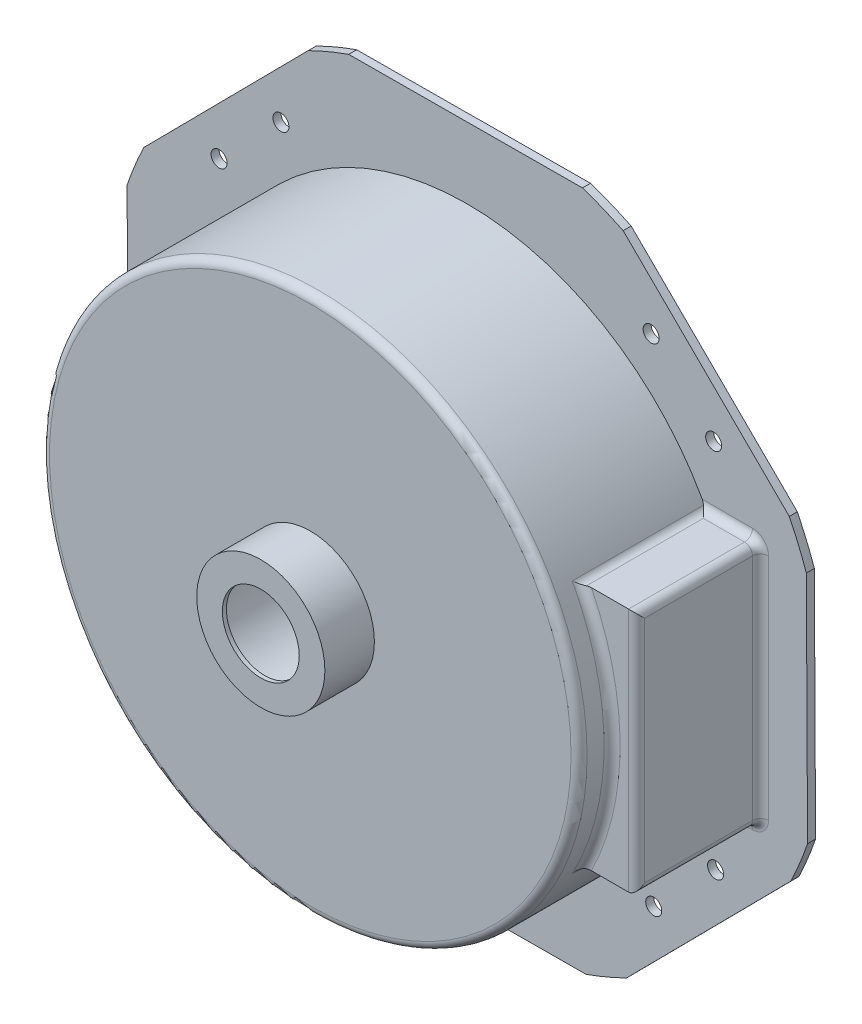
from build123d import *

# Parameters (mm, degrees)
EXTRUDE_1_DEPTH          = 10
SKETCH_2_R               = 335.5
EXTRUDE_2_DEPTH          = 196
EXTRUDE_3_DEPTH          = 154.8
SHELL_START              = 10
SHELL_1_OUTLINE_R        = 330.5
SHELL_1_DEPTH            = 191
SHELL_1_2_DEPTH          = 149.8
CUT_EXTRUDE_4_DEPTH      = 632.790169442
EXTRUDE_4_DEPTH          = 61.8
EXTRUDE_4_DEPTH_BACK     = 128.6
SKETCH_6_R               = 80
SKETCH_9_R               = 75
CUT_EXTRUDE_5_DEPTH      = 185.4
SKETCH_10_R              = 10
CUT_EXTRUDE_6_DEPTH      = 654.608184009
PATTERN_CIRCULAR_1_COUNT = 4
RIB_START                = -5
RIB_1_DEPTH              = 10
PATTERN_CIRCULAR_3_COUNT = 6
RIB_2_REACH              = 659.617
SKETCH_12_WALL_W         = 1579.41836799
SKETCH_12_WALL_H         = 10
SKETCH_13_R              = 48
CUT_EXTRUDE_7_DEPTH      = 658.616649883
FILLET_1_R               = 10


# Read off the part's stored shape, not the designer's step: 抽壳1, 筋1
with BuildPart() as part:
    # 草图1 → 凸台-拉伸1 (new body)
    with BuildSketch(Plane.XY):
        with BuildLine():
            ThreePointArc((403.953420148, -194.523409518), (415.106395354, -169.423738113), (424.701552978, -143.688250731))
            Line((424.701552978, -143.688250731), (423.18702464, 148.0893807))
            ThreePointArc((423.18702464, 148.0893807), (413.325221182, 173.723872955), (401.91228456, 198.706411622))
            Line((401.91228456, 198.706411622), (194.523409518, 403.953420148))
            ThreePointArc((194.523409518, 403.953420148), (169.423738113, 415.106395354), (143.688250731, 424.701552978))
            Line((143.688250731, 424.701552978), (-148.0893807, 423.18702464))
            ThreePointArc((-148.0893807, 423.18702464), (-173.723872955, 413.325221182), (-198.706411622, 401.91228456))
            Line((-198.706411622, 401.91228456), (-403.953420148, 194.523409518))
            ThreePointArc((-403.953420148, 194.523409518), (-415.106395354, 169.423738113), (-424.701552978, 143.688250731))
            Line((-424.701552978, 143.688250731), (-423.18702464, -148.0893807))
            ThreePointArc((-423.18702464, -148.0893807), (-413.325221182, -173.723872955), (-401.91228456, -198.706411622))
            Line((-401.91228456, -198.706411622), (-194.523409518, -403.953420148))
            ThreePointArc((-194.523409518, -403.953420148), (-169.423738113, -415.106395354), (-143.688250731, -424.701552978))
            Line((-143.688250731, -424.701552978), (148.0893807, -423.18702464))
            ThreePointArc((148.0893807, -423.18702464), (173.723872955, -413.325221182), (198.706411622, -401.91228456))
            Line((198.706411622, -401.91228456), (403.953420148, -194.523409518))
        make_face()
    extrude(amount=EXTRUDE_1_DEPTH)

    # 草图4 → 切除-拉伸4 (cut, through all)
    with BuildSketch(Plane(origin=(0, 0, 10), x_dir=(-1, 0, 0), z_dir=(0, 0, -1))):
        with BuildLine():
            Line((-295.51015211, -148), (-361, -148))
            Line((-361, -148), (-361, 148))
            Line((-361, 148), (-295.51015211, 148))
            ThreePointArc((-295.51015211, 148), (330.5, 0), (-295.51015211, -148))
        make_face()
    extrude(amount=CUT_EXTRUDE_4_DEPTH, mode=Mode.SUBTRACT)


with BuildPart() as body_2:
    # 草图2 → 凸台-拉伸2 (new body)
    with BuildSketch(Plane.XY.offset(10)):
        Circle(SKETCH_2_R)
    extrude(amount=EXTRUDE_2_DEPTH)


with BuildPart() as body_3:
    # 草图3 → 凸台-拉伸3 (new body)
    with BuildSketch(Plane.XY.offset(10)):
        with BuildLine():
            Line((366, -153), (366, 153))
            Line((366, 153), (298.582065771, 153))
            ThreePointArc((298.582065771, 153), (335.5, 0), (298.582065771, -153))
            Line((298.582065771, -153), (366, -153))
        make_face()
    extrude(amount=EXTRUDE_3_DEPTH)


with BuildPart() as body_2_1:
    add(body_2.part)

    # Combine 1: union body 3
    add(body_3.part)

    # 抽壳1 outline → 抽壳1 (cut)
    with BuildSketch(Plane.XY.offset(SHELL_START)):
        Circle(SHELL_1_OUTLINE_R)
    extrude(amount=SHELL_1_DEPTH, mode=Mode.SUBTRACT)

    # Shell 1 2 outline → Shell 1 2 (cut)
    with BuildSketch(Plane.XY.offset(SHELL_START)):
        with BuildLine():
            ThreePointArc((295.51015211, 148), (330.5, 0), (295.51015211, -148))
            Line((295.51015211, -148), (361, -148))
            Line((361, -148), (361, 148))
            Line((361, 148), (295.51015211, 148))
        make_face()
    extrude(amount=SHELL_1_2_DEPTH, mode=Mode.SUBTRACT)

    # Combine 2: union part
    add(part.part)

    # 草图6 → 凸台-拉伸4 (add, two sides: drawn at the far end of the back side and taken through both)
    with BuildSketch(Plane.XY.offset(206).offset(-EXTRUDE_4_DEPTH_BACK)):
        Circle(SKETCH_6_R)
    extrude(amount=EXTRUDE_4_DEPTH + EXTRUDE_4_DEPTH_BACK)

    # 草图9 → 切除-拉伸5 (cut)
    with BuildSketch(Plane(origin=(0, 0, 77.4), x_dir=(-1, 0, 0), z_dir=(0, 0, -1))):
        Circle(SKETCH_9_R)
    extrude(amount=-CUT_EXTRUDE_5_DEPTH, mode=Mode.SUBTRACT)

    # 草图10 → 切除-拉伸6 (cut, through all)
    with BuildSketch(Plane.XY.offset(10)):
        with Locations((-232.660524103, 307.498096619)):
            Circle(SKETCH_10_R)
        with Locations((-309.896801034, 229.455816246)):
            Circle(SKETCH_10_R)
    cut_extrude_6 = extrude(amount=-CUT_EXTRUDE_6_DEPTH, mode=Mode.SUBTRACT)

    # 阵列(圆周)1: 切除-拉伸6 ×4 about axis
    pattern_circular_1_axis = Axis((0, 0, 0), (0, 0, 1))
    for i in range(1, PATTERN_CIRCULAR_1_COUNT):
        add(cut_extrude_6.rotate(pattern_circular_1_axis, i * 360 / PATTERN_CIRCULAR_1_COUNT), mode=Mode.SUBTRACT)

    # 筋1 outline → 筋1 (add)
    with BuildSketch(Plane(origin=(0, 0, 0), x_dir=(1, 0, 0), z_dir=(0, 1, 0)).offset(RIB_START)):
        Polygon((-79.843597113, -82.38631652), (-330.5, -104.315910213), (-332, -104.447143208), (-332, -201), (-78, -201), (-78, -82.225022673), align=None)
    rib_1 = extrude(amount=RIB_1_DEPTH)

    # 阵列(圆周)3: 筋1 ×6 about axis, 1 skipped
    pattern_circular_3_axis = Axis((0, 0, 0), (0, 0, 1))
    add([rib_1.rotate(pattern_circular_3_axis, i * 360 / PATTERN_CIRCULAR_3_COUNT) for i in range(1, PATTERN_CIRCULAR_3_COUNT) if i not in (3,)])

    # 草图12 wall → 筋2 (add, up to next)
    with BuildSketch(Plane(origin=(205.25, 0, 121.1), x_dir=(0.955431984347, 0, 0.295211319714), z_dir=(0.295211319714, 0, -0.955431984347)), mode=Mode.PRIVATE) as rib_2_sk1:
        Rectangle(SKETCH_12_WALL_W, SKETCH_12_WALL_H)
    rib_2_tool1 = extrude(rib_2_sk1.sketch, amount=-RIB_2_REACH, mode=Mode.PRIVATE) - body_2_1.part
    add(rib_2_tool1.solids().sort_by_distance((205.25, 0, 121.1))[0])

    # 草图13 → 切除-拉伸7 (cut, through all)
    with BuildSketch(Plane.XY.offset(267.8)):
        Circle(SKETCH_13_R)
    extrude(amount=-CUT_EXTRUDE_7_DEPTH, mode=Mode.SUBTRACT)

    # 圆角1
    fillet_1_edges = [body_2_1.edges().sort_by_distance(p)[0] for p in [
        (-335.5, 0, 206),
        (332.291032885, 153, 10),
        (366, 153, 87.4),
        (298.582065771, 153, 87.4),
        (332.291032885, -153, 10),
        (298.582065771, -153, 87.4),
        (366, 0, 10),
        (366, -153, 87.4),
        (326.139949306, 78.695511098, 164.8),
        (366, 0, 164.8),
    ]]
    fillet(fillet_1_edges, radius=FILLET_1_R)


solid = body_2_1.part
